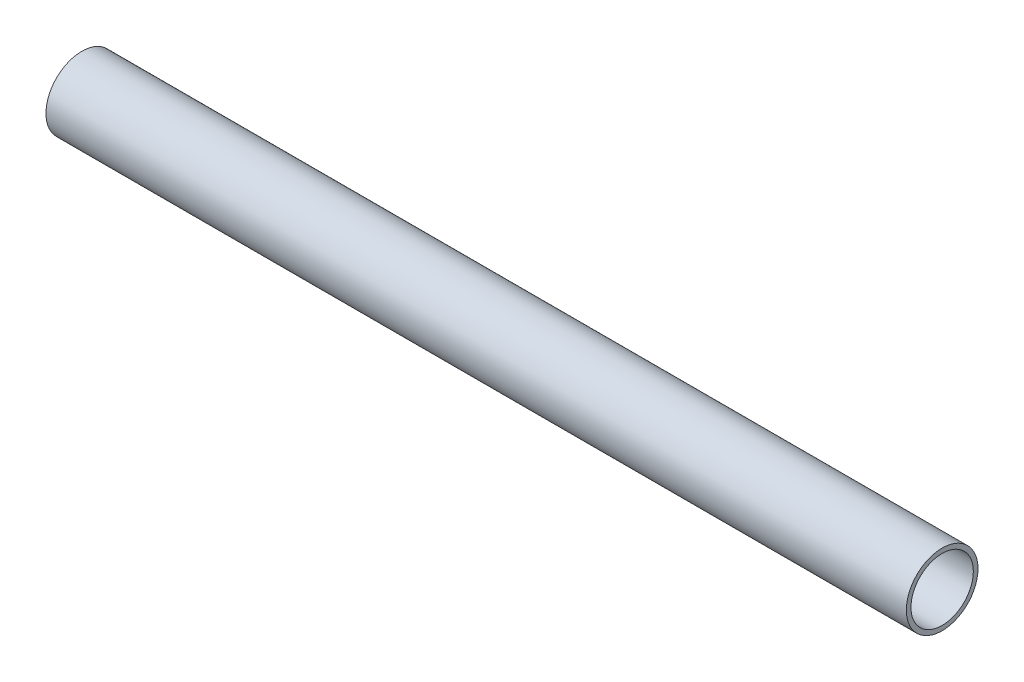
from build123d import *

# Parameters (mm, degrees)
BOSS_EXTRUDE1_DEPTH      = 152.4
BOSS_EXTRUDE1_DEPTH_BACK = 152.4
SKETCH1_R                = 12.7
SKETCH1_R_2              = 11.049


with BuildPart() as part:
    # Sketch1 → Boss-Extrude1 (new, two sides: drawn at the far end of the back side and taken through both)
    with BuildSketch(Plane(origin=(0, 0, 0), x_dir=(0, 0, -1), z_dir=(1, 0, 0)).offset(-BOSS_EXTRUDE1_DEPTH_BACK)):
        Circle(SKETCH1_R)
        Circle(SKETCH1_R_2, mode=Mode.SUBTRACT)
    extrude(amount=BOSS_EXTRUDE1_DEPTH + BOSS_EXTRUDE1_DEPTH_BACK)


solid = part.part
